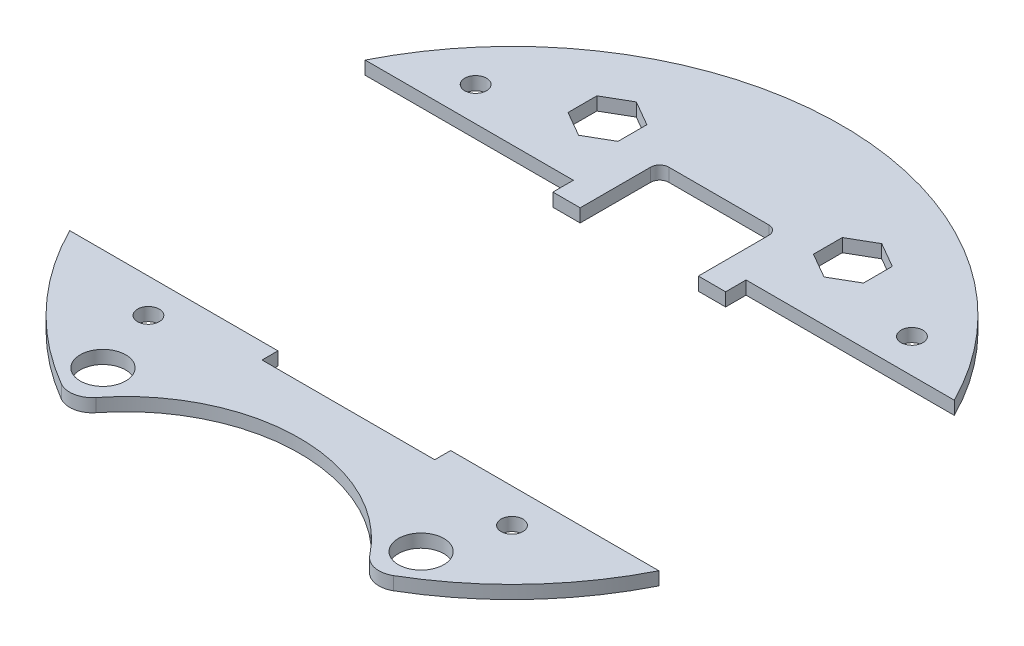
from build123d import *

# Parameters (mm, degrees)
BOSS_EXTRUDE1_DEPTH  = 2.9
SOLENOID_PLACEMENT_W = 38
SOLENOID_PLACEMENT_H = 64
CUT_EXTRUDE1_DEPTH   = 103.571487266
CUT_EXTRUDE4_DEPTH   = 103.571487266
CUT_EXTRUDE5_DEPTH   = 103.571487266
SKETCH6_R            = 2.4
CUT_EXTRUDE6_DEPTH   = 103.571487266
CUT_EXTRUDE3_DEPTH   = 103.571487266
SKETCH7_R            = 5
CUT_EXTRUDE7_DEPTH   = 98.286484159


with BuildPart() as part:
    # Sketch1 → Boss-Extrude1 (new body)
    with BuildSketch(Plane(origin=(0, 0, 0), x_dir=(1, 0, 0), z_dir=(0, 1, 0))):
        with BuildLine():
            ThreePointArc((36.543377003, -62.616544118), (0, 72.5), (-36.543377003, -62.616544118))
            ThreePointArc((-36.543377003, -62.616544118), (-33.085954668, -63.20954405), (-30.089832649, -61.38507948))
            ThreePointArc((-30.089832649, -61.38507948), (0, -46.75), (30.089832649, -61.38507948))
            ThreePointArc((30.089832649, -61.38507948), (33.085954668, -63.20954405), (36.543377003, -62.616544118))
        make_face()
    extrude(amount=BOSS_EXTRUDE1_DEPTH)

    # solenoid placement → Cut-Extrude1 (cut, through all)
    with BuildSketch(Plane(origin=(0, 2.9, 0), x_dir=(1, 0, 0), z_dir=(0, 1, 0))):
        with Locations((0, -4)):
            Rectangle(SOLENOID_PLACEMENT_W, SOLENOID_PLACEMENT_H)
    extrude(amount=-CUT_EXTRUDE1_DEPTH, mode=Mode.SUBTRACT)

    # Sketch4 → Cut-Extrude4 (cut, through all)
    with BuildSketch(Plane(origin=(0, 2.9, 0), x_dir=(1, 0, 0), z_dir=(0, 1, 0))):
        with BuildLine():
            Line((13, 28), (13, 43.5))
            ThreePointArc((13, 43.5), (12.414213562, 44.914213562), (11, 45.5))
            Line((11, 45.5), (-11, 45.5))
            ThreePointArc((-11, 45.5), (-12.414213562, 44.914213562), (-13, 43.5))
            Line((-13, 43.5), (-13, 28))
            Line((-13, 28), (13, 28))
        make_face()
    extrude(amount=-CUT_EXTRUDE4_DEPTH, mode=Mode.SUBTRACT)

    # Sketch5 → Cut-Extrude5 (cut, through all)
    with BuildSketch(Plane(origin=(0, 2.9, 0), x_dir=(1, 0, 0), z_dir=(0, 1, 0))):
        Polygon((-21.5, 51.175426481), (-27, 54.350852961), (-32.5, 51.175426481), (-32.5, 44.824573519), (-27, 41.649147039), (-21.5, 44.824573519), align=None)
        Polygon((21.5, 51.175426481), (21.5, 44.824573519), (27, 41.649147039), (32.5, 44.824573519), (32.5, 51.175426481), (27, 54.350852961), align=None)
    extrude(amount=-CUT_EXTRUDE5_DEPTH, mode=Mode.SUBTRACT)

    # Sketch6 → Cut-Extrude6 (cut, through all)
    with BuildSketch(Plane(origin=(0, 2.9, 0), x_dir=(1, 0, 0), z_dir=(0, 1, 0))):
        with Locations((40, -40)):
            Circle(SKETCH6_R)
        with Locations((-40, -40)):
            Circle(SKETCH6_R)
        with Locations((48, 40)):
            Circle(SKETCH6_R)
        with Locations((-48, 40)):
            Circle(SKETCH6_R)
    extrude(amount=-CUT_EXTRUDE6_DEPTH, mode=Mode.SUBTRACT)

    # Sketch3 → Cut-Extrude3 (cut, through all)
    with BuildSketch(Plane(origin=(0, 2.9, 0), x_dir=(1, 0, 0), z_dir=(0, 1, 0))):
        Polygon((-19, 28), (-19, 32.5), (-72.5, 32.5), (-72.5, -32.5), (72.5, -32.5), (72.5, 32.5), (19, 32.5), (19, 28), align=None)
    extrude(amount=-CUT_EXTRUDE3_DEPTH, mode=Mode.SUBTRACT)


with BuildPart() as cut_extrude3_piece_1:
    # of the separate pieces the step leaves, piece 1, a body of its own (cut_extrude3_pieces)
    add(part.part.solids().sort_by_distance((64.807406984, 0, -32.5))[0])


with BuildPart() as cut_extrude3_piece_2:
    # of the separate pieces the step leaves, piece 2, a body of its own (cut_extrude3_pieces)
    add(part.part.solids().sort_by_distance((-36.543377003, 0, 62.616544118))[0])

    # Sketch7 → Cut-Extrude7 (cut, through all)
    with BuildSketch(Plane(origin=(0, 2.9, 0), x_dir=(1, 0, 0), z_dir=(0, 1, 0))):
        with Locations((35, -55)):
            Circle(SKETCH7_R)
        with Locations((-35, -55)):
            Circle(SKETCH7_R)
    extrude(amount=-CUT_EXTRUDE7_DEPTH, mode=Mode.SUBTRACT)


solid = Compound([cut_extrude3_piece_1.part, cut_extrude3_piece_2.part])
